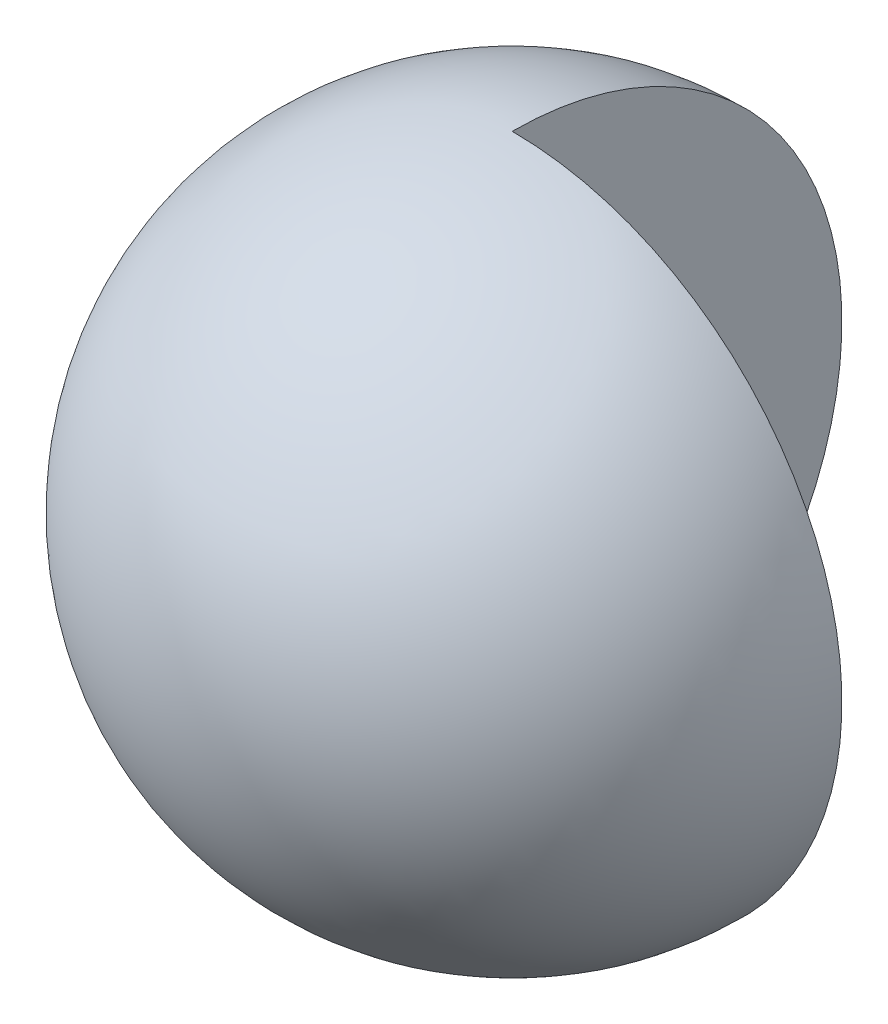
from build123d import *

# Parameters (mm, degrees)
CUT_EXTRUDE3_DEPTH = 21


with BuildPart() as part:
    # Sketch2 → Revolve2 (revolve)
    with BuildSketch(Plane.XY):
        with BuildLine():
            Line((0, 5), (0, -5))
            ThreePointArc((0, -5), (5, 0), (0, 5))
        make_face()
    revolve(axis=Axis((0, 5, 0), (0, -1, 0)))

    # Sketch2<2> → Cut-Extrude3 (cut)
    with BuildSketch(Plane.XY):
        with BuildLine():
            Line((0, 5), (0, -5))
            ThreePointArc((0, -5), (5, 0), (0, 5))
        make_face()
    extrude(amount=-CUT_EXTRUDE3_DEPTH, mode=Mode.SUBTRACT)


solid = part.part
